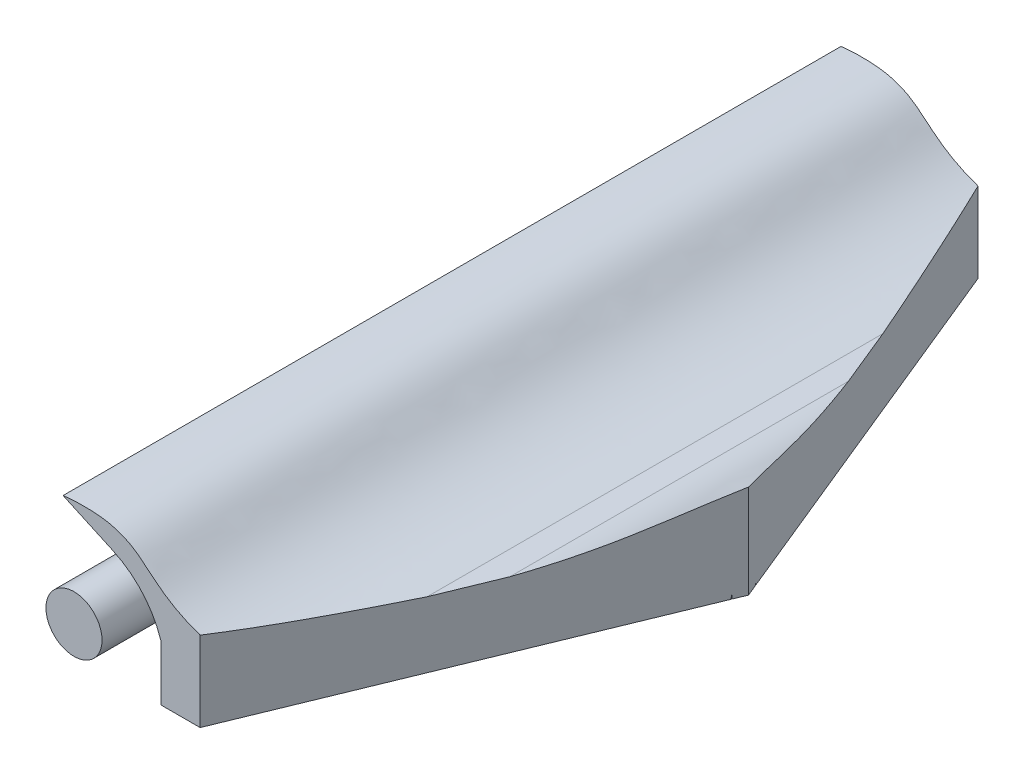
from build123d import *
from build123d.topology import SkipClean

# Parameters (mm, degrees)
BOSS_EXTRUDE1_DEPTH              = 55.49
BOSS_EXTRUDE5_DEPTH              = 4
BOSS_EXTRUDE6_START              = 51.49
BOSS_EXTRUDE6_DEPTH              = 4
BOSS_EXTRUDE7_START              = 5.6
BOSS_EXTRUDE7_DEPTH              = 44.29
SKETCH1_11_R                     = 2
BOSS_EXTRUDE8_DEPTH              = 55.59
BOSS_EXTRUDE9_DEPTH              = 55.49
BOSS_EXTRUDE10_REACH             = 60.551
SKETCH3_W                        = 44.29
SKETCH3_H                        = 4
BOSS_EXTRUDE11_START             = -49.89
BOSS_EXTRUDE11_DEPTH             = 55.49
CUT_EXTRUDE1_DEPTH               = 55.59
CUT_EXTRUDE1_DEPTH_BACK          = 55.59
BOSS_EXTRUDE12_DEPTH             = 49.59
BOSS_EXTRUDE12_DIRECTION_2_REACH = 60.225
BOSS_EXTRUDE13_DEPTH             = 4
BOSS_EXTRUDE14_START             = 51.49
BOSS_EXTRUDE14_DEPTH             = 4
BOSS_EXTRUDE15_DEPTH             = 0.3
CUT_EXTRUDE2_DEPTH               = 5.5
CUT_EXTRUDE3_START               = 55.49
CUT_EXTRUDE3_DEPTH               = 5.5
BOSS_EXTRUDE16_DEPTH             = 4
CUT_EXTRUDE4_DEPTH               = 5.5
CUT_EXTRUDE5_START               = -55.49
CUT_EXTRUDE5_DEPTH               = 5.5
CUT_EXTRUDE6_DEPTH               = 10
CUT_EXTRUDE6_DEPTH_BACK          = 10
CUT_EXTRUDE7_DEPTH               = 10


# Read off the part's stored shape, not the designer's step: Boss-Extrude6
with BuildPart() as part:
    # Sketch1 → Boss-Extrude1 (new body)
    with BuildSketch(Plane.XY):
        with BuildLine():
            ThreePointArc((1.129915274, -2.230087773), (-2.325656227, -0.917236673), (-0.696579505, 2.400995001))
            Line((-0.696579505, 2.400995001), (0.839733193, 4.443342601))
            Line((0.839733193, 4.443342601), (1.672696268, 5.550669345))
            Line((1.672696268, 5.550669345), (-1.620002468, 5.749465478))
            Line((-1.620002468, 5.749465478), (-3.736897473, 3.873630853))
            Line((-3.736897473, 3.873630853), (-4.07142398, -1.667196274))
            ThreePointArc((-4.07142398, -1.667196274), (-3.634366728, -2.93327365), (-2.430068683, -3.519479403))
            Line((-2.430068683, -3.519479403), (4.898910437, -3.961965286))
            Line((4.898910437, -3.961965286), (5.462782558, -3.357258899))
            Line((5.462782558, -3.357258899), (5.295730888, -2.964633462))
            Line((5.295730888, -2.964633462), (3.885857643, -2.716034769))
            Line((3.885857643, -2.716034769), (1.129915274, -2.230087773))
        make_face()
    extrude(amount=BOSS_EXTRUDE1_DEPTH)

    # Sketch1<8> → Boss-Extrude5 (add)
    with BuildSketch(Plane.XY):
        Polygon((1.672696268, 5.550669345), (0.839733193, 4.443342601), (3.885857643, -2.716034769), (5.295730888, -2.964633462), align=None)
    extrude(amount=BOSS_EXTRUDE5_DEPTH)

    # Boss-Extrude6 outline → Boss-Extrude6 (add)
    with BuildSketch(Plane.XY.offset(BOSS_EXTRUDE6_START)):
        Polygon((3.885857643, -2.71603477), (5.295730888, -2.964633462), (1.672696268, 5.550669345), (0.839733193, 4.443342601), align=None)
    extrude(amount=BOSS_EXTRUDE6_DEPTH)


with BuildPart() as body_2:
    # Sketch1<10> → Boss-Extrude7 (new body)
    with BuildSketch(Plane.XY.offset(BOSS_EXTRUDE7_START)):
        with BuildLine():
            Line((0, -2), (12, -2))
            Line((12, -2), (12, 2))
            Line((12, 2), (0, 2))
            ThreePointArc((0, 2), (-2, 0), (0, -2))
        make_face()
    extrude(amount=BOSS_EXTRUDE7_DEPTH)

    # Sketch1<11> → Boss-Extrude8 (add)
    with BuildSketch(Plane.XY):
        Circle(SKETCH1_11_R)
    extrude(amount=BOSS_EXTRUDE8_DEPTH)


with BuildPart() as body_3:
    # Sketch1<12> → Boss-Extrude9 (new body)
    with BuildSketch(Plane.XY):
        with BuildLine():
            Line((22.5, 2), (20.149982379, 2))
            Line((20.149982379, 2), (19.92857602, -1.667196274))
            ThreePointArc((19.92857602, -1.667196274), (19.926466234, -1.833875846), (19.940224749, -2))
            Line((19.940224749, -2), (22.5, -2))
            ThreePointArc((22.5, -2), (21.5, 0), (22.5, 2))
        make_face()
        with BuildLine():
            Line((20.263102527, 3.873630853), (20.149982379, 2))
            Line((20.149982379, 2), (22.5, 2))
            ThreePointArc((22.5, 2), (22.883559394, 2.236863959), (23.303420495, 2.400995001))
            Line((23.303420495, 2.400995001), (24.839733193, 4.443342601))
            Line((24.839733193, 4.443342601), (25.672696268, 5.550669345))
            Line((25.672696268, 5.550669345), (22.379997532, 5.749465478))
            Line((22.379997532, 5.749465478), (20.263102527, 3.873630853))
        make_face()
        with BuildLine():
            Line((22.5, -2), (19.940224749, -2))
            ThreePointArc((19.940224749, -2), (20.482001684, -3.052625751), (21.569931317, -3.519479403))
            Line((21.569931317, -3.519479403), (28.898910437, -3.961965286))
            Line((28.898910437, -3.961965286), (29.462782558, -3.357258899))
            Line((29.462782558, -3.357258899), (29.295730888, -2.964633462))
            Line((29.295730888, -2.964633462), (27.885857643, -2.716034769))
            Line((27.885857643, -2.716034769), (25.129915274, -2.230087773))
            ThreePointArc((25.129915274, -2.230087773), (23.782110643, -2.490486745), (22.5, -2))
        make_face()
    extrude(amount=BOSS_EXTRUDE9_DEPTH)

    # Boss-Extrude10: up to this face of the body (flat: up to its plane)
    boss_extrude10_end = Plane(body_3.part.faces().sort_by_distance((20.095839274, 1.10321729, 27.745))[0])
    # Sketch3 → Boss-Extrude10 (add, up to the picked face)
    with BuildSketch(Plane(origin=(12, 0, 0), x_dir=(0, 0, -1), z_dir=(1, 0, 0)), mode=Mode.PRIVATE) as boss_extrude10_sk1:
        with Locations((-27.745, 0)):
            Rectangle(SKETCH3_W, SKETCH3_H)
    boss_extrude10_tool1 = split(extrude(boss_extrude10_sk1.sketch, amount=BOSS_EXTRUDE10_REACH, mode=Mode.PRIVATE), bisect_by=boss_extrude10_end, keep=Keep.BOTH, mode=Mode.PRIVATE)

    add(body_2.part)  # Boss-Extrude10 merges body 2
    add(boss_extrude10_tool1.solids().sort_by(Axis((12, 0, 27.745), (1, 0, 0)))[0])

    # Sketch4 → Boss-Extrude11 (add)
    with BuildSketch(Plane.XY.offset(49.89).offset(BOSS_EXTRUDE11_START)):
        with BuildLine():
            Line((20.263102527, 3.873630853), (25.672696268, 5.550669345))
            add(Edge.make_bspline(
                [(18.253064845, 3.63105347), (20.126675338, 4.576543011), (21.657010209, 5.806862999), (25.672696268, 5.550669345)],
                knots=[0.306550142, 0.306550142, 0.306550142, 0.306550142, 1, 1, 1, 1], degree=3))
            add(Edge.make_bspline(
                [(15.322676772, 2.697160199), (16.529464831, 2.850779242), (17.424806601, 3.213085323), (18.253064845, 3.63105347)],
                knots=[0, 0, 0, 0, 0.306550142, 0.306550142, 0.306550142, 0.306550142], degree=3))
            Line((15.322676772, 2.697160199), (13.609149986, 2.697160199))
            Line((13.609149986, 2.697160199), (13.609149986, 2))
            Line((13.609149986, 2), (0, 2))
            ThreePointArc((0, 2), (2, 0), (0, -2))
            Line((0, -2), (6.092058814, -2))
            Line((6.092058814, -2), (19.908483051, -2))
            Line((19.908483051, -2), (20.263102527, 3.873630853))
        make_face()
    extrude(amount=BOSS_EXTRUDE11_DEPTH)

    # Sketch4<5> → Cut-Extrude1 (cut, two sides: drawn at the far end of the back side and taken through both)
    with BuildSketch(Plane.XY.offset(49.89).offset(-CUT_EXTRUDE1_DEPTH_BACK)):
        with BuildLine():
            add(Edge.make_bspline(
                [(18.253064845, 3.63105347), (20.126675338, 4.576543011), (21.657010209, 5.806862999), (25.672696268, 5.550669345)],
                knots=[0.306550142, 0.306550142, 0.306550142, 0.306550142, 1, 1, 1, 1], degree=3))
            Line((25.672696268, 5.550669345), (19.033452373, 9.878906939))
            Line((19.033452373, 9.878906939), (18.253064845, 3.63105347))
        make_face()
    extrude(amount=CUT_EXTRUDE1_DEPTH + CUT_EXTRUDE1_DEPTH_BACK, mode=Mode.SUBTRACT)

    # Sketch4<6> → Boss-Extrude12 (add)
    with BuildSketch(Plane.XY.offset(49.89)):
        with BuildLine():
            Line((6.092058814, 2), (13.609149986, 2))
            Line((13.609149986, 2), (13.609149986, 2.697160199))
            add(Edge.make_bspline(
                [(13.609149986, 2.697160199), (3.008937487, 4.043912628), (6.643549935, 7.427073901), (2.231724762, 7.792821065), (-0.877126137, 7.449933099)],
                knots=[0, 0, 0, 0, 0, 1, 1, 1, 1, 1], degree=4))
            Line((-0.877126137, 7.449933099), (2.665214437, 5.830739223))
            ThreePointArc((2.665214437, 5.830739223), (4.778774076, 4.27366426), (6.091049818, 2))
            Line((6.091049818, 2), (6.092058814, 2))
        make_face()
    extrude(amount=-BOSS_EXTRUDE12_DEPTH)

    # Boss-Extrude12 direction 2: up to this face of the body (flat: up to its plane)
    boss_extrude12_direction_2_end = Plane(body_3.part.faces().sort_by_distance((14.730018873, 0.349949508, 55.49))[0])
    # Sketch4<6> → Boss-Extrude12 direction 2 (add, up to the picked face)
    with BuildSketch(Plane.XY.offset(49.89), mode=Mode.PRIVATE) as boss_extrude12_direction_2_sk1:
        with BuildLine():
            Line((6.092058814, 2), (13.609149986, 2))
            Line((13.609149986, 2), (13.609149986, 2.697160199))
            add(Edge.make_bspline(
                [(13.609149986, 2.697160199), (3.008937487, 4.043912628), (6.643549935, 7.427073901), (2.231724762, 7.792821065), (-0.877126137, 7.449933099)],
                knots=[0, 0, 0, 0, 0, 1, 1, 1, 1, 1], degree=4))
            Line((-0.877126137, 7.449933099), (2.665214437, 5.830739223))
            ThreePointArc((2.665214437, 5.830739223), (4.778774076, 4.27366426), (6.091049818, 2))
            Line((6.091049818, 2), (6.092058814, 2))
        make_face()
    boss_extrude12_direction_2_tool1 = split(extrude(boss_extrude12_direction_2_sk1.sketch, amount=BOSS_EXTRUDE12_DIRECTION_2_REACH, mode=Mode.PRIVATE), bisect_by=boss_extrude12_direction_2_end, keep=Keep.BOTH, mode=Mode.PRIVATE)
    add(boss_extrude12_direction_2_tool1.solids().sort_by(Axis((6.524615, 4.223787, 49.89), (0, 0, 1)))[0])

    # Sketch1<13> → Boss-Extrude13 (add)
    with BuildSketch(Plane.XY):
        Polygon((25.672696268, 5.550669345), (24.839733193, 4.443342601), (27.885857643, -2.716034769), (29.295730888, -2.964633462), align=None)
    extrude(amount=BOSS_EXTRUDE13_DEPTH)

    # Sketch1<14> → Boss-Extrude14 (add)
    with BuildSketch(Plane.XY.offset(BOSS_EXTRUDE14_START)):
        Polygon((25.672696268, 5.550669345), (24.839733193, 4.443342601), (27.885857643, -2.716034769), (29.295730888, -2.964633462), align=None)
    extrude(amount=BOSS_EXTRUDE14_DEPTH)

    # Sketch5 → Boss-Extrude15 (add)
    with BuildSketch(Plane(origin=(0, 0, 0.3), x_dir=(-1, 0, 0), z_dir=(0, 0, -1))):
        with BuildLine():
            Line((-13.609149986, 2), (-6.091302067, 2))
            ThreePointArc((-6.091302067, 2), (-4.778900201, 4.273690642), (-2.665214437, 5.830739223))
            Line((-2.665214437, 5.830739223), (0.877126137, 7.449933099))
            add(Edge.make_bspline(
                [(0.877126137, 7.449933099), (-2.231724762, 7.792821065), (-6.643549935, 7.427073901), (-3.008937487, 4.043912628), (-13.609149986, 2.697160199)],
                knots=[0, 0, 0, 0, 0, 1, 1, 1, 1, 1], degree=4))
            Line((-13.609149986, 2.697160199), (-13.609149986, 2))
        make_face()
    extrude(amount=BOSS_EXTRUDE15_DEPTH)

    # Sketch1<15> → Cut-Extrude2 (cut)
    with SkipClean():  # the faces are left unmerged after this step: merging them gives an invalid solid
        with BuildSketch(Plane.XY):
            with BuildLine():
                Line((0, -2), (4.885305034, -2))
                Line((4.885305034, -2), (3.183411536, 2))
                Line((3.183411536, 2), (0, 2))
                ThreePointArc((0, 2), (2, 0), (0, -2))
            make_face()
        extrude(amount=CUT_EXTRUDE2_DEPTH, mode=Mode.SUBTRACT)

    # Sketch1<16> → Cut-Extrude3 (cut)
    with SkipClean():  # the faces are left unmerged after this step: merging them gives an invalid solid
        with BuildSketch(Plane.XY.offset(CUT_EXTRUDE3_START)):
            with BuildLine():
                Line((0, -2), (4.885305034, -2))
                Line((4.885305034, -2), (3.183411536, 2))
                Line((3.183411536, 2), (0, 2))
                ThreePointArc((0, 2), (2, 0), (0, -2))
            make_face()
        extrude(amount=-CUT_EXTRUDE3_DEPTH, mode=Mode.SUBTRACT)

    # Sketch1<17> → Boss-Extrude16 (add)
    with SkipClean():  # the faces are left unmerged after this step: merging them gives an invalid solid
        with BuildSketch(Plane.XY):
            with BuildLine():
                Line((24.839733193, 4.443342601), (23.303420495, 2.400995001))
                ThreePointArc((23.303420495, 2.400995001), (25.50142453, 1.998930809), (26.5, 0))
                ThreePointArc((26.5, 0), (26.499999366, -0.001781138), (26.499997462, -0.003562276))
                ThreePointArc((26.499997462, -0.003562276), (26.129183075, -1.310182978), (25.129915274, -2.230087773))
                Line((25.129915274, -2.230087773), (27.885857643, -2.716034769))
                Line((27.885857643, -2.716034769), (24.839733193, 4.443342601))
            make_face()
        extrude(amount=BOSS_EXTRUDE16_DEPTH)

    # Sketch6 → Cut-Extrude4 (cut)
    with SkipClean():  # the faces are left unmerged after this step: merging them gives an invalid solid
        with BuildSketch(Plane(origin=(0, 0, 0), x_dir=(-1, 0, 0), z_dir=(0, 0, -1))):
            Polygon((-3.183411536, 2), (-6.091302067, 2), (-6.091302067, -2), (-4.885305034, -2), align=None)
        extrude(amount=-CUT_EXTRUDE4_DEPTH, mode=Mode.SUBTRACT)

    # Sketch6<3> → Cut-Extrude5 (cut)
    with SkipClean():  # the faces are left unmerged after this step: merging them gives an invalid solid
        with BuildSketch(Plane(origin=(0, 0, 0), x_dir=(-1, 0, 0), z_dir=(0, 0, -1)).offset(CUT_EXTRUDE5_START)):
            Polygon((-3.183411536, 2), (-6.091302067, 2), (-6.091302067, -2), (-4.885305034, -2), align=None)
        extrude(amount=CUT_EXTRUDE5_DEPTH, mode=Mode.SUBTRACT)

    # Sketch8 → Cut-Extrude6 (cut, two sides: drawn at the far end of the back side and taken through both)
    with SkipClean():  # the faces are left unmerged after this step: merging them gives an invalid solid
        with BuildSketch(Plane(origin=(0, 0, 0), x_dir=(1, 0, 0), z_dir=(0, 1, 0)).offset(-CUT_EXTRUDE6_DEPTH_BACK)):
            Polygon((8.89773256, -55.49), (20.272550796, -27.745), (8.89773256, 0), (9.632888589, 3.803128997), (30.927801349, 3.803128997), (32.833315741, -63.036420075), (8.89773256, -70.58284015), align=None)
        extrude(amount=CUT_EXTRUDE6_DEPTH + CUT_EXTRUDE6_DEPTH_BACK, mode=Mode.SUBTRACT)

    # Sketch9 → Cut-Extrude7 (cut, along a direction that is not the sketch's normal)
    with SkipClean():  # the faces are left unmerged after this step: merging them gives an invalid solid
        with BuildSketch(Plane(origin=(27.093463658, 0, 11.107703171), x_dir=(0.3793352445024156, 0, -0.9252593000225896), z_dir=(0.9252593000225896, 0, 0.3793352445024156))):
            with BuildLine():
                Line((-17.981226266, -2), (-18.857301063, -2))
                add(Edge.make_bspline(
                    [(-18.857301063, -2), (-18.700912393, -2.452788244), (-17.981226266, -2.818856866)],
                    knots=[3.273172267, 3.273172267, 3.273172267, 3.782379861, 3.782379861, 3.782379861], degree=2, weights=[0.975822264, 0.955830127, 1]))
                Line((-17.981226266, -2.818856866), (-17.981226266, -2))
            make_face()
        extrude(amount=-CUT_EXTRUDE7_DEPTH, dir=(0.3793352445024153, 0, 0.9252593000225898), mode=Mode.SUBTRACT)


solid = body_3.part
